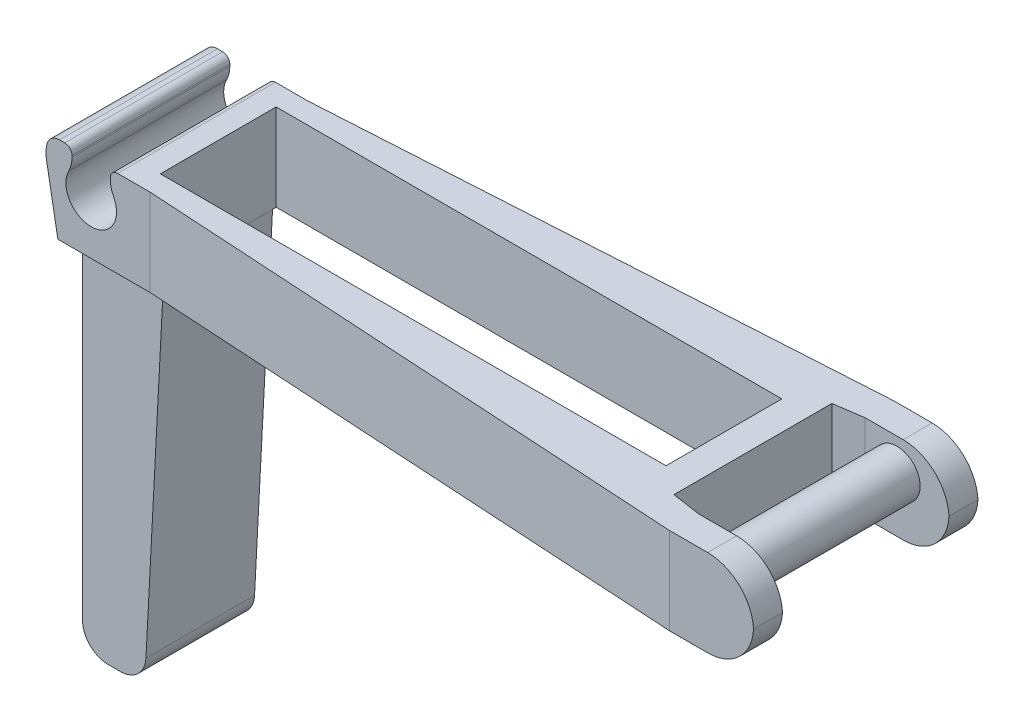
from build123d import *

# Parameters (mm, degrees)
BOSS_EXTRUDE1_DEPTH   = 5.45
BOSS_EXTRUDE1_2_DEPTH = 5.45
BOSS_EXTRUDE2_DEPTH   = 5.75
BOSS_EXTRUDE3_DEPTH   = 6.001690088
FILLET1_R             = 3.175
SKETCH3_W             = 34.925
SKETCH3_H             = 8
CUT_EXTRUDE1_DEPTH    = 28.618228517
BOSS_EXTRUDE5_DEPTH   = 3.75
FILLET2_R             = 1.778


with BuildPart() as part:
    # Sketch1 → Boss-Extrude1 (new, symmetric)
    with BuildSketch(Plane.XY):
        with BuildLine():
            ThreePointArc((20.625, 0.15), (20.842969199, -0.656220109), (21.43748858, -1.242776279))
            ThreePointArc((21.43748858, -1.242776279), (23.824989974, 0.155664255), (21.42764708, 1.537165571))
            ThreePointArc((21.42764708, 1.537165571), (20.840123711, 0.951322447), (20.625, 0.15))
        make_face()
    extrude(amount=BOSS_EXTRUDE1_DEPTH, both=True)

    # Sketch1<4> → Boss-Extrude2 (add, symmetric)
    with BuildSketch(Plane.XY):
        with BuildLine():
            ThreePointArc((20.625, 0.15), (20.842969199, -0.656220109), (21.43748858, -1.242776279))
            ThreePointArc((21.43748858, -1.242776279), (23.824989974, 0.155664255), (21.42764708, 1.537165571))
            ThreePointArc((21.42764708, 1.537165571), (20.840123711, 0.951322447), (20.625, 0.15))
        make_face()
    extrude(amount=BOSS_EXTRUDE2_DEPTH, both=True)



with BuildPart() as body_2:
    # Sketch1 → Boss-Extrude1 2 (new, symmetric)
    with BuildSketch(Plane.XY):
        with BuildLine():
            Line((-24.525, -3.647655774), (18.025, -3.647655774))
            Line((18.025, -3.647655774), (18.025, 2.354034313))
            Line((18.025, 2.354034313), (-18.725, 2.354034313))
            Line((-18.725, 2.354034313), (-20.4, 2.354034313))
            ThreePointArc((-20.4, 2.354034313), (-20.753553391, 2.207587704), (-20.9, 1.854034313))
            Line((-20.9, 1.854034313), (-20.9, 1.734034313))
            ThreePointArc((-20.9, 1.734034313), (-20.842506971, 1.257939085), (-20.673333333, 0.809216013))
            ThreePointArc((-20.673333333, 0.809216013), (-22.225, -1.75), (-23.776666667, 0.809216013))
            ThreePointArc((-23.776666667, 0.809216013), (-23.607493029, 1.257939085), (-23.55, 1.734034313))
            Line((-23.55, 1.734034313), (-23.55, 1.854034313))
            ThreePointArc((-23.55, 1.854034313), (-23.696446609, 2.207587704), (-24.05, 2.354034313))
            Line((-24.05, 2.354034313), (-24.409724637, 2.354034313))
            ThreePointArc((-24.409724637, 2.354034313), (-24.974960254, 2.154397574), (-25.289436326, 1.644053639))
            ThreePointArc((-25.289436326, 1.644053639), (-25.345434425, 1.158547963), (-25.305905598, 0.671424755))
            Line((-25.305905598, 0.671424755), (-24.525, -3.647655774))
        make_face()
    extrude(amount=BOSS_EXTRUDE1_2_DEPTH, both=True)


with BuildPart() as part_1:
    add(part.part)

    add(body_2.part)  # Boss-Extrude3 merges body 2
    # Sketch2 → Boss-Extrude3 (add)
    with BuildSketch(Plane(origin=(0, -3.647655774, 0), x_dir=(-1, 0, 0), z_dir=(0, -1, 0))):
        Polygon((18.175, 5.45), (-18.025, 5.45), (18.175, 0), align=None)
        Polygon((-25.825, 7.75), (-25.825, 5.75), (-20.01766055, 5.75), (-18.025, 5.45), (18.175, 5.45), (-20.01766055, 7.75), align=None)
        Polygon((18.175, -5.45), (18.175, 0), (-18.025, -5.45), align=None)
        Polygon((-20.01766055, -7.75), (18.175, -5.45), (-18.025, -5.45), (-20.01766055, -5.75), (-25.825, -5.75), (-25.825, -7.75), align=None)
    extrude(amount=-BOSS_EXTRUDE3_DEPTH)

    # Fillet1
    # the kernel refuses this fillet: 3.175 mm, written as the material it takes off along each edge
    with BuildSketch(Plane(origin=(25.825, 2.354034313, -15.687500001), x_dir=(-1, 0, 0), z_dir=(0, 0, 1)), Plane(origin=(25.825, 2.354034313, -2.187500001), x_dir=(-1, 0, 0), z_dir=(0, 0, 1))) as fillet1_piece_1:
        with BuildLine():
            CenterArc((FILLET1_R, FILLET1_R), FILLET1_R, 180, 90)
            Line((0, FILLET1_R), (0, 0))
            Line((0, 0), (FILLET1_R, 0))
        make_face()
    extrude(amount=17.875000002, mode=Mode.SUBTRACT)
    with BuildSketch(Plane(origin=(25.825, -3.647655774, -15.6875), x_dir=(-1, 0, 0), z_dir=(0, 0, 1))) as fillet1_piece_2:
        with BuildLine():
            CenterArc((FILLET1_R, -FILLET1_R), FILLET1_R, 90, 90)
            Line((0, -FILLET1_R), (0, 0))
            Line((0, 0), (FILLET1_R, 0))
        make_face()
    extrude(amount=17.875, mode=Mode.SUBTRACT)
    with BuildSketch(Plane(origin=(25.825, -3.647655774, -2.1875), x_dir=(0, 1, 0), z_dir=(0, 0, 1))) as fillet1_piece_3:
        with BuildLine():
            CenterArc((FILLET1_R, FILLET1_R), FILLET1_R, 180, 90)
            Line((0, FILLET1_R), (0, 0))
            Line((0, 0), (FILLET1_R, 0))
        make_face()
    extrude(amount=17.875, mode=Mode.SUBTRACT)

    # Sketch3 → Cut-Extrude1 (cut, through all)
    with BuildSketch(Plane(origin=(0, -3.647655774, 0), x_dir=(-1, 0, 0), z_dir=(0, -1, 0))):
        with Locations((1.4375, 0)):
            Rectangle(SKETCH3_W, SKETCH3_H)
    extrude(amount=-CUT_EXTRUDE1_DEPTH, mode=Mode.SUBTRACT)

    # Sketch4 → Boss-Extrude5 (add, symmetric)
    with BuildSketch(Plane.XY):
        Polygon((-18.9, -3.647655774), (-20.231157594, -29.047655774), (-24.525, -29.047655774), (-24.525, -3.647655774), align=None)
    extrude(amount=BOSS_EXTRUDE5_DEPTH, both=True)

    # Fillet2
    fillet2_edges = [part_1.edges().sort_by_distance(p)[0] for p in [
        (-24.525, -29.047655774, 0),
        (-20.231157594, -29.047655774, 0),
    ]]
    fillet(fillet2_edges, radius=FILLET2_R)


solid = part_1.part
